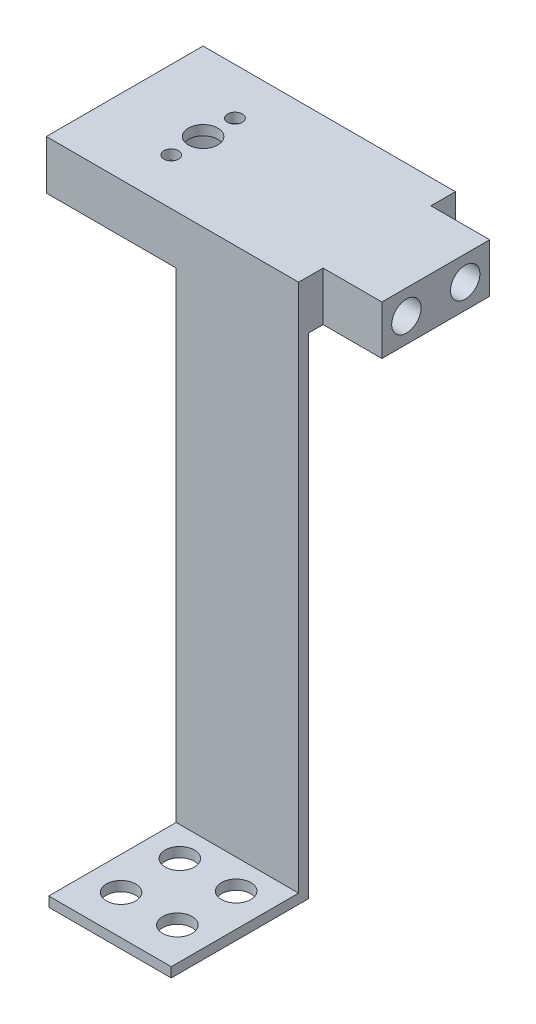
from build123d import *

# Parameters (mm, degrees)
BOSS_EXTRUDE1_DEPTH = 10
SKETCH2_R           = 3
CUT_EXTRUDE1_DEPTH  = 10
SKETCH4_R           = 11
CUT_EXTRUDE3_DEPTH  = 8
SKETCH5_R           = 3
SKETCH5_R_2         = 1.5
CUT_EXTRUDE4_DEPTH  = 8
SKETCH7_W           = 25
SKETCH7_H           = 2
BOSS_EXTRUDE2_DEPTH = 100
SKETCH8_W           = 25
SKETCH8_H           = 2
BOSS_EXTRUDE3_DEPTH = 28
SKETCH9_R           = 3
CUT_EXTRUDE6_DEPTH  = 12


with BuildPart() as part:
    # Sketch1 → Boss-Extrude1 (new body)
    with BuildSketch(Plane(origin=(0, 0, 0), x_dir=(1, 0, 0), z_dir=(0, 1, 0))):
        Polygon((5.5, 11), (5.5, 16), (-46, 16), (-46, -16), (5.5, -16), (5.5, -11), (17.5, -11), (17.5, 11), align=None)
    extrude(amount=BOSS_EXTRUDE1_DEPTH)

    # Sketch2 → Cut-Extrude1 (cut)
    with BuildSketch(Plane(origin=(17.5, 0, 0), x_dir=(0, 0, -1), z_dir=(1, 0, 0))):
        with Locations((-6, 5)):
            Circle(SKETCH2_R)
        with Locations((6, 5)):
            Circle(SKETCH2_R)
    extrude(amount=-CUT_EXTRUDE1_DEPTH, mode=Mode.SUBTRACT)

    # Sketch4 → Cut-Extrude3 (cut)
    with BuildSketch(Plane.XZ):
        with Locations((-30, 0)):
            Circle(SKETCH4_R)
    extrude(amount=-CUT_EXTRUDE3_DEPTH, mode=Mode.SUBTRACT)

    # Sketch5 → Cut-Extrude4 (cut)
    with BuildSketch(Plane(origin=(0, 8, 0), x_dir=(-1, 0, 0), z_dir=(0, -1, 0))):
        with Locations((30, 0)):
            Circle(SKETCH5_R)
        with Locations((30, 6.5)):
            Circle(SKETCH5_R_2)
        with Locations((30, -6.5)):
            Circle(SKETCH5_R_2)
    extrude(amount=-CUT_EXTRUDE4_DEPTH, mode=Mode.SUBTRACT)

    # Sketch7 → Boss-Extrude2 (add)
    with BuildSketch(Plane(origin=(0, 0, 0), x_dir=(-1, 0, 0), z_dir=(0, -1, 0))):
        with Locations((7, -15)):
            Rectangle(SKETCH7_W, SKETCH7_H)
    extrude(amount=BOSS_EXTRUDE2_DEPTH)

    # Sketch8 → Boss-Extrude3 (add)
    with BuildSketch(Plane(origin=(0, 0, 14), x_dir=(-1, 0, 0), z_dir=(0, 0, -1))):
        with Locations((7, -99)):
            Rectangle(SKETCH8_W, SKETCH8_H)
    extrude(amount=-BOSS_EXTRUDE3_DEPTH)

    # Sketch9 → Cut-Extrude6 (cut)
    with BuildSketch(Plane(origin=(0, -100, 0), x_dir=(-1, 0, 0), z_dir=(0, -1, 0))):
        with Locations((1.25, -22)):
            Circle(SKETCH9_R)
        with Locations((12.75, -22)):
            Circle(SKETCH9_R)
        with Locations((1.25, -34)):
            Circle(SKETCH9_R)
        with Locations((12.75, -34)):
            Circle(SKETCH9_R)
    extrude(amount=-CUT_EXTRUDE6_DEPTH, mode=Mode.SUBTRACT)


solid = part.part
